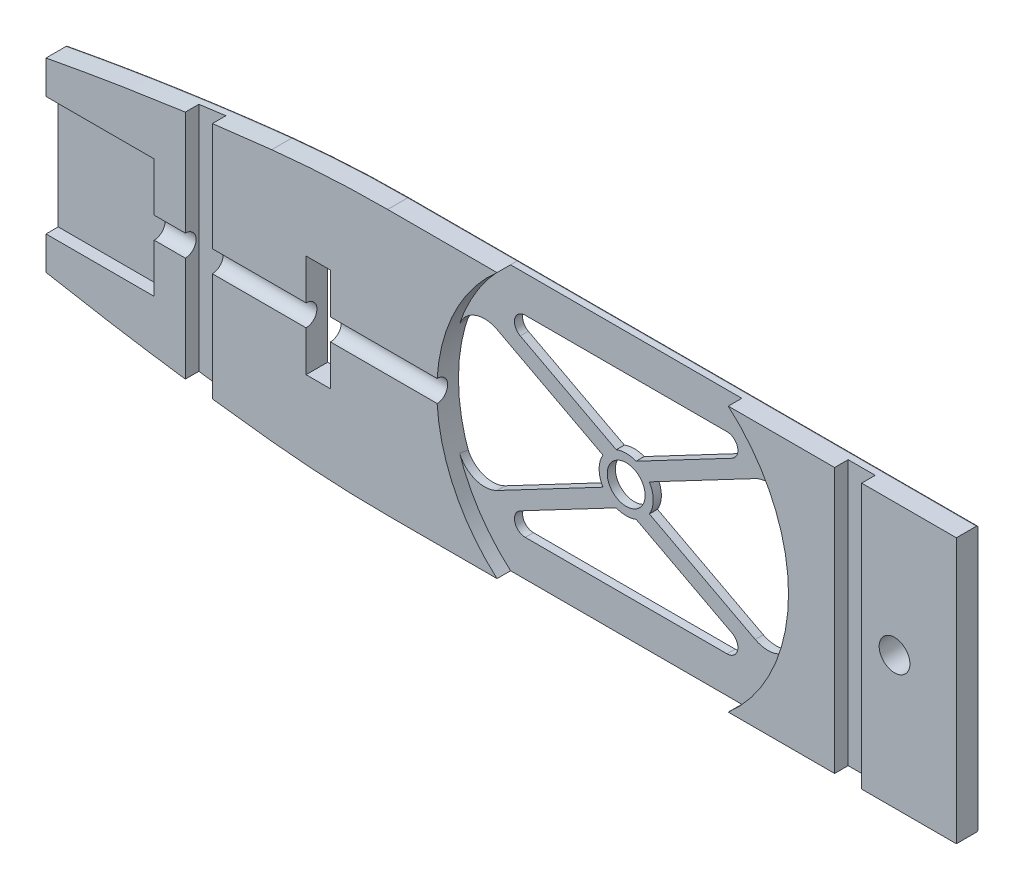
from build123d import *
from build123d.topology import SkipClean

# Parameters (mm, degrees)
BOSS_EXTRUDE1_DEPTH      = 8
FILLET2_R                = 2
SKETCH3_R                = 2.839661977
CUT_EXTRUDE1_DEPTH       = 8
SKETCH4_R                = 3.5
CUT_EXTRUDE2_DEPTH       = 8
CUT_EXTRUDE3_DEPTH       = 2.5
CUT_EXTRUDE3_DEPTH_BACK  = 2.5
SKETCH5_R                = 32.5
SKETCH6_W                = 4.5
SKETCH6_H                = 19
CUT_EXTRUDE4_DEPTH       = 10
SKETCH7_W                = 5
SKETCH7_H                = 5
CUT_EXTRUDE5_DEPTH       = 51
FILLET3_START            = -1
FILLET3_DEPTH            = 10
FILLET4_START            = -1
FILLET4_DEPTH            = 10
SKETCH9_W                = 5
SKETCH9_H                = 5
CUT_EXTRUDE6_DEPTH       = 51
CUT_EXTRUDE7_DEPTH       = 64
CUT_EXTRUDE7_DEPTH_BACK  = 25
SKETCH10_R               = 2
FILLET5_DEPTH            = 1.5
FILLET5_START            = 6.5
FILLET5_2_DEPTH          = 1.5
CUT_EXTRUDE8_START       = -4
CUT_EXTRUDE8_DEPTH       = 4
FILLET6_R                = 0.3
SKETCH13_W               = 4.5
SKETCH13_H               = 22
CUT_EXTRUDE9_DEPTH       = 20
SURFACE_EXTRUDE2_1_BACK  = 5
SURFACE_EXTRUDE2_1_DEPTH = 5
SURFACE_EXTRUDE2_2_BACK  = 5
SURFACE_EXTRUDE2_2_DEPTH = 5


with BuildPart() as part:
    # Sketch2 → Boss-Extrude1 (new body)
    with BuildSketch(Plane.XY):
        with BuildLine():
            Line((-102.95960155, 17.159933592), (-102.95960155, -17.159933592))
            add(Edge.make_bspline(
                [(-102.95960155, -17.159933592), (-76.189992309, -22.210205625), (-49.286425804, -24.488951052)],
                knots=[0, 0, 0, 0.320704871, 0.320704871, 0.320704871], degree=2))
            Line((-49.286425804, -24.488951052), (65.285160882, -24.488951052))
            Line((65.285160882, -24.488951052), (65.285160882, 24.488951052))
            Line((65.285160882, 24.488951052), (-49.286425804, 24.488951052))
            add(Edge.make_bspline(
                [(-102.95960155, 17.159933592), (-76.189992309, 22.210205625), (-49.286425804, 24.488951052)],
                knots=[0, 0, 0, 0.320704871, 0.320704871, 0.320704871], degree=2))
        make_face()
        with BuildLine():
            Line((-24.971677166, 17.771677006), (28.500163837, 17.771677006))
            Line((28.500163837, 17.771677006), (3.599814154, 4.650879462))
            ThreePointArc((3.599814154, 4.650879462), (1.764243335, 5), (-0.071327484, 4.650879462))
            Line((-0.071327484, 4.650879462), (-24.971677166, 17.771677006))
        make_face(mode=Mode.SUBTRACT)
        with BuildLine():
            Line((3.599814154, -4.650879462), (28.500163837, -17.771677006))
            Line((28.500163837, -17.771677006), (-24.971677166, -17.771677006))
            Line((-24.971677166, -17.771677006), (-0.071327484, -4.650879462))
            ThreePointArc((-0.071327484, -4.650879462), (1.764243335, -5), (3.599814154, -4.650879462))
        make_face(mode=Mode.SUBTRACT)
        with BuildLine():
            Line((-2.525196045, 2.569184657), (-26.859859934, 15.391904107))
            ThreePointArc((-26.859859934, 15.391904107), (-30.735756665, 0), (-26.859859934, -15.391904107))
            Line((-26.859859934, -15.391904107), (-2.525196045, -2.569184657))
            ThreePointArc((-2.525196045, -2.569184657), (-3.235756665, 0), (-2.525196045, 2.569184657))
        make_face(mode=Mode.SUBTRACT)
        with BuildLine():
            Line((6.053682716, -2.569184657), (30.388346604, -15.391904107))
            ThreePointArc((30.388346604, -15.391904107), (34.264243335, 0), (30.388346604, 15.391904107))
            Line((30.388346604, 15.391904107), (6.053682716, 2.569184657))
            ThreePointArc((6.053682716, 2.569184657), (6.764243335, 0), (6.053682716, -2.569184657))
        make_face(mode=Mode.SUBTRACT)
    extrude(amount=BOSS_EXTRUDE1_DEPTH)

    # Fillet2
    fillet2_edges = [part.edges().sort_by_distance(p)[0] for p in [
        (-24.971677166, 17.771677006, 4),
        (28.500163837, 17.771677006, 4),
        (-24.971677166, -17.771677006, 4),
        (28.500163837, -17.771677006, 4),
    ]]
    fillet(fillet2_edges, radius=FILLET2_R)

    # Sketch3 → Cut-Extrude1 (cut)
    with BuildSketch(Plane.XY.offset(8)):
        with Locations((53.859940094, 0)):
            Circle(SKETCH3_R)
    extrude(amount=-CUT_EXTRUDE1_DEPTH, mode=Mode.SUBTRACT)

    # Sketch4 → Cut-Extrude2 (cut)
    with BuildSketch(Plane.XY.offset(8)):
        with Locations((1.764243335, 0)):
            Circle(SKETCH4_R)
    extrude(amount=-CUT_EXTRUDE2_DEPTH, mode=Mode.SUBTRACT)

    # Sketch5 → Cut-Extrude3 (cut, two sides: drawn at the far end of the back side and taken through both)
    with SkipClean():  # the faces are left unmerged after this step: merging them gives an invalid solid
        with BuildSketch(Plane.XY.offset(4).offset(-CUT_EXTRUDE3_DEPTH_BACK)):
            with Locations((1.764243335, 0)):
                Circle(SKETCH5_R)
        extrude(amount=CUT_EXTRUDE3_DEPTH + CUT_EXTRUDE3_DEPTH_BACK, mode=Mode.SUBTRACT)

    # Sketch6 → Cut-Extrude4 (cut)
    with SkipClean():  # the faces are left unmerged after this step: merging them gives an invalid solid
        with BuildSketch(Plane.XY.offset(8)):
            with Locations((-52.644112073, 0)):
                Rectangle(SKETCH6_W, SKETCH6_H)
        extrude(amount=-CUT_EXTRUDE4_DEPTH, mode=Mode.SUBTRACT)

    # Sketch7 → Cut-Extrude5 (cut)
    with SkipClean():  # the faces are left unmerged after this step: merging them gives an invalid solid
        with BuildSketch(Plane(origin=(0, 24.488951052, 0), x_dir=(1, 0, 0), z_dir=(0, 1, 0))):
            with Locations((45.285160882, -4)):
                Rectangle(SKETCH7_W, SKETCH7_H)
        extrude(amount=-CUT_EXTRUDE5_DEPTH, mode=Mode.SUBTRACT)

    # Fillet3: read off the stored shape, not the designer's step
    # Fillet3 outline → Fillet3 (cut)
    with SkipClean():  # the faces are left unmerged after this step: merging them gives an invalid solid
        with BuildSketch(Plane.XY.offset(FILLET3_START)):
            with BuildLine():
                add(Edge.make_bspline(
                    [(-49.286425804, 24.488951052), (-55.269151656, 23.982211205), (-61.245253134, 23.338415518)],
                    knots=[0, 0, 0, 0.071317285, 0.071317285, 0.071317285], degree=2))
                ThreePointArc((-61.245253134, 23.338415518), (-50.549825889, 24.201110037), (-39.823523948, 24.488951052))
                Line((-39.823523948, 24.488951052), (-49.286425804, 24.488951052))
            make_face()
        extrude(amount=FILLET3_DEPTH, mode=Mode.SUBTRACT)

    # Fillet4: read off the stored shape, not the designer's step
    # Fillet4 outline → Fillet4 (cut)
    with SkipClean():  # the faces are left unmerged after this step: merging them gives an invalid solid
        with BuildSketch(Plane.XY.offset(FILLET4_START)):
            with BuildLine():
                Line((-49.286425804, -24.488951052), (-39.823523948, -24.488951052))
                ThreePointArc((-39.823523948, -24.488951052), (-50.549825889, -24.201110037), (-61.245253134, -23.338415518))
                add(Edge.make_bspline(
                    [(-61.245253134, -23.338415518), (-55.269151656, -23.982211205), (-49.286425804, -24.488951052)],
                    knots=[0.249387586, 0.249387586, 0.249387586, 0.320704871, 0.320704871, 0.320704871], degree=2))
            make_face()
        extrude(amount=FILLET4_DEPTH, mode=Mode.SUBTRACT)

    # Sketch9 → Cut-Extrude6 (cut)
    with SkipClean():  # the faces are left unmerged after this step: merging them gives an invalid solid
        with BuildSketch(Plane(origin=(0, 24.488951052, 0), x_dir=(1, 0, 0), z_dir=(0, 1, 0))):
            with Locations((-74.714839118, -4)):
                Rectangle(SKETCH9_W, SKETCH9_H)
        extrude(amount=-CUT_EXTRUDE6_DEPTH, mode=Mode.SUBTRACT)

    # Sketch10 → Cut-Extrude7 (cut, two sides: drawn at the far end of the back side and taken through both)
    with SkipClean():  # the faces are left unmerged after this step: merging them gives an invalid solid
        with BuildSketch(Plane.ZY.offset(50.394112073).offset(-CUT_EXTRUDE7_DEPTH_BACK)):
            with Locations(Location((4, 0, 0), (0, 0, 180))):
                Circle(SKETCH10_R)
        extrude(amount=CUT_EXTRUDE7_DEPTH + CUT_EXTRUDE7_DEPTH_BACK, mode=Mode.SUBTRACT)

    # Fillet5: read off the stored shape, not the designer's step
    # Fillet5 outline → Fillet5 (add)
    with SkipClean():  # the faces are left unmerged after this step: merging them gives an invalid solid
        with BuildSketch(Plane.XY):
            with BuildLine():
                Line((30.388346604, 15.391904107), (25.603831674, 12.87078884))
                ThreePointArc((25.603831674, 12.87078884), (29.820861326, 13.077915151), (32.692963641, 9.983198898))
                ThreePointArc((32.692963641, 9.983198898), (31.663210239, 12.739771507), (30.388346604, 15.391904107))
            make_face()
            with BuildLine():
                ThreePointArc((30.388346604, -15.391904107), (31.663210239, -12.739771507), (32.692963641, -9.983198898))
                ThreePointArc((32.692963641, -9.983198898), (29.820861326, -13.077915151), (25.603831674, -12.87078884))
                Line((25.603831674, -12.87078884), (30.388346604, -15.391904107))
            make_face()
            with BuildLine():
                Line((-26.859859934, -15.391904107), (-22.075345003, -12.87078884))
                ThreePointArc((-22.075345003, -12.87078884), (-26.292374655, -13.077915151), (-29.164476971, -9.983198898))
                ThreePointArc((-29.164476971, -9.983198898), (-28.134723569, -12.739771507), (-26.859859934, -15.391904107))
            make_face()
            with BuildLine():
                ThreePointArc((-26.859859934, 15.391904107), (-28.134723569, 12.739771507), (-29.164476971, 9.983198898))
                ThreePointArc((-29.164476971, 9.983198898), (-26.292374655, 13.077915151), (-22.075345003, 12.87078884))
                Line((-22.075345003, 12.87078884), (-26.859859934, 15.391904107))
            make_face()
        extrude(amount=FILLET5_DEPTH)

    # Fillet5 2 outline → Fillet5 2 (add)
    with SkipClean():  # the faces are left unmerged after this step: merging them gives an invalid solid
        with BuildSketch(Plane.XY.offset(FILLET5_START)):
            with BuildLine():
                Line((30.388346604, 15.391904107), (25.603831674, 12.87078884))
                ThreePointArc((25.603831674, 12.87078884), (29.820861326, 13.077915151), (32.692963641, 9.983198898))
                ThreePointArc((32.692963641, 9.983198898), (31.663210239, 12.739771507), (30.388346604, 15.391904107))
            make_face()
            with BuildLine():
                ThreePointArc((30.388346604, -15.391904107), (31.663210239, -12.739771507), (32.692963641, -9.983198898))
                ThreePointArc((32.692963641, -9.983198898), (29.820861326, -13.077915151), (25.603831674, -12.87078884))
                Line((25.603831674, -12.87078884), (30.388346604, -15.391904107))
            make_face()
            with BuildLine():
                Line((-26.859859934, -15.391904107), (-22.075345003, -12.87078884))
                ThreePointArc((-22.075345003, -12.87078884), (-26.292374655, -13.077915151), (-29.164476971, -9.983198898))
                ThreePointArc((-29.164476971, -9.983198898), (-28.134723569, -12.739771507), (-26.859859934, -15.391904107))
            make_face()
            with BuildLine():
                ThreePointArc((-26.859859934, 15.391904107), (-28.134723569, 12.739771507), (-29.164476971, 9.983198898))
                ThreePointArc((-29.164476971, 9.983198898), (-26.292374655, 13.077915151), (-22.075345003, 12.87078884))
                Line((-22.075345003, 12.87078884), (-26.859859934, 15.391904107))
            make_face()
        extrude(amount=FILLET5_2_DEPTH)


with BuildPart() as body_2:
    # Split1: read off the stored shape, not the designer's step
    # Split1: the piece on the far side of the plane
    add(part.part)
    split(bisect_by=Plane.XY.offset(4), keep=Keep.BOTTOM)

    # Fillet6
    fillet6_edges = [body_2.edges().sort_by_distance(p)[0] for p in [
        (-82.163571081, 20.662100298, 0),
        (-82.163571081, -20.662100298, 0),
        (12.730818467, -24.488951052, 0),
        (12.730818467, 24.488951052, 0),
        (-50.549825889, 24.201110037, 0),
        (-50.549825889, -24.201110037, 0),
    ]]
    fillet(fillet6_edges, radius=FILLET6_R)

    # Sketch13 → Cut-Extrude9 (cut)
    with SkipClean():  # the faces are left unmerged after this step: merging them gives an invalid solid
        with BuildSketch(Plane.ZY.offset(102.95960155)):
            with Locations((4, 0)):
                Rectangle(SKETCH13_W, SKETCH13_H)
        extrude(amount=-CUT_EXTRUDE9_DEPTH, mode=Mode.SUBTRACT)


with BuildPart() as part_1:
    add(part.part)

    # Split1
    split(bisect_by=Plane.XY.offset(4), keep=Keep.TOP)

    # Sketch12 → Cut-Extrude8 (cut)
    with BuildSketch(Plane.XY.offset(8).offset(CUT_EXTRUDE8_START)):
        with BuildLine():
            Line((-39.823523948, -24.488951052), (65.285160882, -24.488951052))
            Line((65.285160882, -24.488951052), (65.285160882, 24.488951052))
            Line((65.285160882, 24.488951052), (-39.823523948, 24.488951052))
            ThreePointArc((-39.823523948, 24.488951052), (-50.549825889, 24.201110037), (-61.245253134, 23.338415518))
            add(Edge.make_bspline(
                [(-61.245253134, 23.338415518), (-82.142929204, 21.087142885), (-102.959601581, 17.159933586)],
                knots=[0, 0, 0, 1, 1, 1], degree=2))
            Line((-102.959601581, 17.159933586), (-102.959601388, -17.159933622))
            add(Edge.make_bspline(
                [(-102.959601388, -17.159933622), (-82.142929109, -21.087142896), (-61.245253139, -23.338415518)],
                knots=[0, 0, 0, 1, 1, 1], degree=2))
            ThreePointArc((-61.245253139, -23.338415518), (-50.549825891, -24.201110037), (-39.823523948, -24.488951052))
        make_face()
    extrude(amount=CUT_EXTRUDE8_DEPTH, mode=Mode.SUBTRACT)


with BuildPart() as body_2_2:
    # Split2: the piece behind the surface
    add(body_2.part)
    # Surface-Extrude2: a surface, the sketch's curves swept straight by 5 mm
    with BuildLine(Plane.XY.offset(1.5).offset(-SURFACE_EXTRUDE2_1_BACK), mode=Mode.PRIVATE) as surface_extrude2_1_path:
        ThreePointArc((-18.386509966, 25.498963535), (-30.729424728, -0.641510544), (-17.364366662, -26.274441565))
    surface_extrude2_1 = Shell.extrude(surface_extrude2_1_path.wire(), (0 * SURFACE_EXTRUDE2_1_DEPTH, 0 * SURFACE_EXTRUDE2_1_DEPTH, 1 * SURFACE_EXTRUDE2_1_DEPTH))
    split(bisect_by=surface_extrude2_1, keep=Keep.BOTTOM)


with BuildPart() as body_2_1:
    add(body_2.part)

    # Split2: split by a surface, the side it looks to stays
    # Surface-Extrude2: a surface, the sketch's curves swept straight by 5 mm
    with BuildLine(Plane.XY.offset(1.5).offset(-SURFACE_EXTRUDE2_2_BACK), mode=Mode.PRIVATE) as surface_extrude2_2_path:
        ThreePointArc((-18.386509966, 25.498963535), (-30.729424728, -0.641510544), (-17.364366662, -26.274441565))
    surface_extrude2_2 = Shell.extrude(surface_extrude2_2_path.wire(), (0 * SURFACE_EXTRUDE2_2_DEPTH, 0 * SURFACE_EXTRUDE2_2_DEPTH, 1 * SURFACE_EXTRUDE2_2_DEPTH))
    split(bisect_by=surface_extrude2_2, keep=Keep.TOP)


solid = Compound([body_2_2.part, body_2_1.part])
